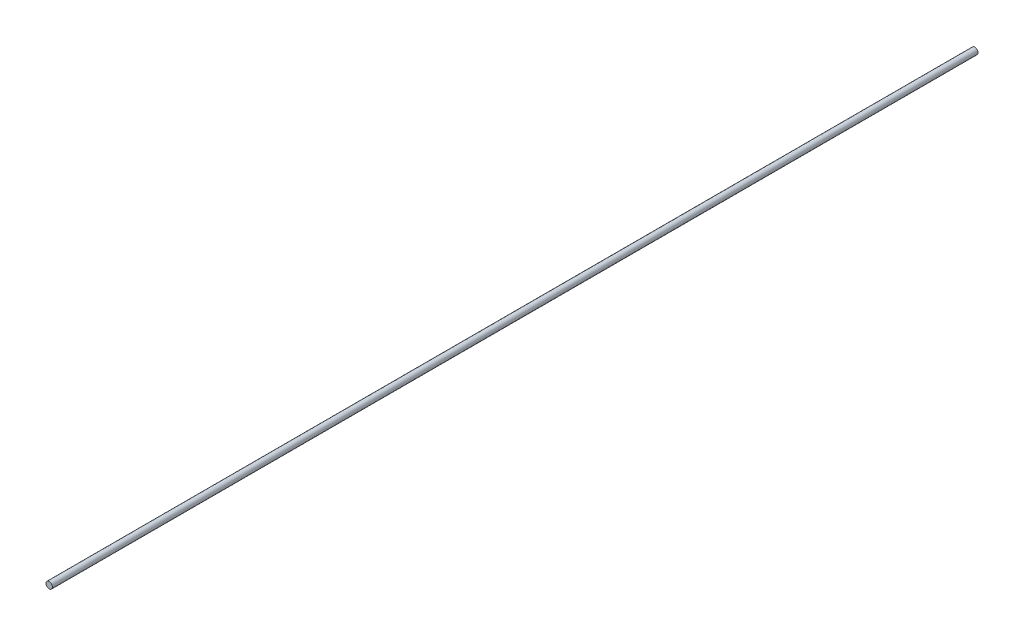
from build123d import *

# Parameters (mm, degrees)
SKETCH1_R           = 3.175
BOSS_EXTRUDE1_DEPTH = 457.2


with BuildPart() as part:
    # Sketch1 → Boss-Extrude1 (new, symmetric)
    with BuildSketch(Plane.XY):
        Circle(SKETCH1_R)
    extrude(amount=BOSS_EXTRUDE1_DEPTH, both=True)


solid = part.part
